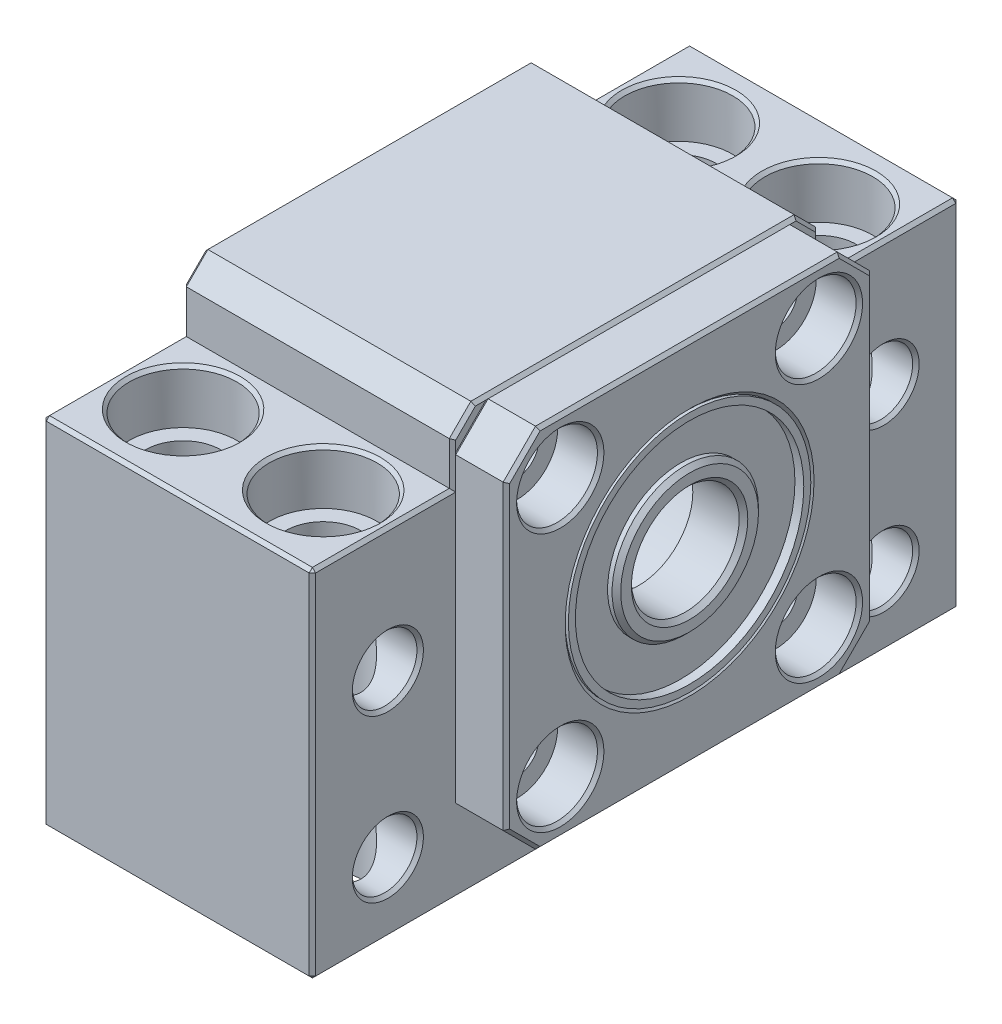
from build123d import *

# Parameters (mm, degrees)
BOSS_EXTRUDE1_DEPTH = 12.5
SKETCH2_W           = 34
SKETCH2_H           = 34
BOSS_EXTRUDE2_DEPTH = 5
SKETCH4_R           = 11.25
SKETCH4_R_2         = 2
SKETCH4_R_3         = 3
CUT_EXTRUDE1_DEPTH  = 48.791212581
SKETCH5_R           = 3.75
CUT_EXTRUDE2_DEPTH  = 4
SKETCH6_R           = 3.5
CUT_EXTRUDE3_DEPTH  = 48.908767465
SKETCH7_R           = 5
CUT_EXTRUDE4_DEPTH  = 5
CHAMFER1_SIZE       = 2
CHAMFER2_SIZE       = 3
CHAMFER3_SIZE       = 0.3
CHAMFER4_SIZE       = 0.3
CHAMFER5_SIZE       = 0.4


with BuildPart() as part:
    # Sketch1 → Boss-Extrude1 (new, symmetric)
    with BuildSketch(Plane(origin=(0, 0, 0), x_dir=(0, 0, -1), z_dir=(1, 0, 0))):
        Polygon((17, 17), (-17, 17), (-17, 11), (-30, 11), (-30, -22), (30, -22), (30, 11), (17, 11), align=None)
    extrude(amount=BOSS_EXTRUDE1_DEPTH, both=True)

    # Sketch2 → Boss-Extrude2 (add)
    with BuildSketch(Plane(origin=(12.5, 0, 0), x_dir=(0, 0, -1), z_dir=(1, 0, 0))):
        Rectangle(SKETCH2_W, SKETCH2_H)
    extrude(amount=BOSS_EXTRUDE2_DEPTH)

    # Sketch4 → Cut-Extrude1 (cut, through all)
    with BuildSketch(Plane(origin=(17.5, 0, 0), x_dir=(0, 0, -1), z_dir=(1, 0, 0))):
        Circle(SKETCH4_R)
        with Locations((-12, 12)):
            Circle(SKETCH4_R_2)
        with Locations((12, 12)):
            Circle(SKETCH4_R_2)
        with Locations((12, -12)):
            Circle(SKETCH4_R_2)
        with Locations((-12, -12)):
            Circle(SKETCH4_R_2)
        with Locations((-23, -0.5)):
            Circle(SKETCH4_R_3)
        with Locations((-23, -15.5)):
            Circle(SKETCH4_R_3)
        with Locations((23, -15.5)):
            Circle(SKETCH4_R_3)
        with Locations((23, -0.5)):
            Circle(SKETCH4_R_3)
    extrude(amount=-CUT_EXTRUDE1_DEPTH, mode=Mode.SUBTRACT)

    # Sketch5 → Cut-Extrude2 (cut)
    with BuildSketch(Plane(origin=(17.5, 0, 0), x_dir=(0, 0, -1), z_dir=(1, 0, 0))):
        with Locations((-12, 12)):
            Circle(SKETCH5_R)
        with Locations((12, 12)):
            Circle(SKETCH5_R)
        with Locations((12, -12)):
            Circle(SKETCH5_R)
        with Locations((-12, -12)):
            Circle(SKETCH5_R)
    extrude(amount=-CUT_EXTRUDE2_DEPTH, mode=Mode.SUBTRACT)

    # Sketch6 → Cut-Extrude3 (cut, through all)
    with BuildSketch(Plane(origin=(0, 11, 0), x_dir=(1, 0, 0), z_dir=(0, 1, 0))):
        with Locations((-6.5, 23)):
            Circle(SKETCH6_R)
        with Locations((6.5, 23)):
            Circle(SKETCH6_R)
        with Locations((-6.5, -23)):
            Circle(SKETCH6_R)
        with Locations((6.5, -23)):
            Circle(SKETCH6_R)
    extrude(amount=-CUT_EXTRUDE3_DEPTH, mode=Mode.SUBTRACT)

    # Sketch7 → Cut-Extrude4 (cut)
    with BuildSketch(Plane(origin=(0, 11, 0), x_dir=(1, 0, 0), z_dir=(0, 1, 0))):
        with Locations((-6.5, 23)):
            Circle(SKETCH7_R)
        with Locations((6.5, 23)):
            Circle(SKETCH7_R)
        with Locations((6.5, -23)):
            Circle(SKETCH7_R)
        with Locations((-6.5, -23)):
            Circle(SKETCH7_R)
    extrude(amount=-CUT_EXTRUDE4_DEPTH, mode=Mode.SUBTRACT)


with BuildPart() as body_2:
    # Split1: the piece on the far side of the plane
    add(part.part)
    split(bisect_by=Plane(origin=(12.5, 0, 0), x_dir=(0, 0, 1), z_dir=(1, 0, 0)), keep=Keep.BOTTOM)

    # Chamfer1
    chamfer1_edges = [body_2.edges().sort_by_distance(p)[0] for p in [
        (0, 17, -17),
        (0, 17, 17),
    ]]
    chamfer(chamfer1_edges, length=CHAMFER1_SIZE)

    # Chamfer4
    chamfer4_edges = [body_2.edges().sort_by_distance(p)[0] for p in [
        (-12.5, 0, 11.25),
        (-12.5, 12, 14),
        (-12.5, 12, -10),
        (-12.5, -12, -10),
        (-12.5, -12, 14),
        (-12.5, -0.5, 26),
        (-12.5, -15.5, 26),
        (-12.5, -15.5, -20),
        (-12.5, -0.5, -20),
        (12.5, -0.5, 26),
        (12.5, -15.5, 26),
        (12.5, -15.5, -20),
        (12.5, -0.5, -20),
        (12.5, -12, -10),
        (12.5, 12, 14),
        (12.5, 0, 11.25),
        (0, -22, -30),
        (0, 11, -30),
        (0, 11, 30),
        (-12.5, 16, 16),
        (-12.5, 13, 17),
        (-12.5, 11, 23.5),
        (-12.5, -5.5, 30),
        (-12.5, 17, 0),
        (-12.5, 16, -16),
        (-12.5, 13, -17),
        (-12.5, 11, -23.5),
        (-12.5, -5.5, -30),
        (-12.5, -22, 0),
        (0, -22, 30),
        (12.5, 11, -23.5),
        (12.5, -5.5, -30),
        (12.5, -22, 0),
        (12.5, -5.5, 30),
        (12.5, 11, 23.5),
        (12.5, 13, 17),
        (12.5, 16, 16),
        (12.5, 17, 0),
        (12.5, 16, -16),
        (12.5, 13, -17),
        (12.5, -12, 14),
        (12.5, 12, -10),
        (1.5, 11, -23),
        (-11.5, 11, -23),
        (-11.5, 11, 23),
        (1.5, 11, 23),
    ]]
    chamfer(chamfer4_edges, length=CHAMFER4_SIZE)


with BuildPart() as part_1:
    add(part.part)

    # Split1
    split(bisect_by=Plane(origin=(12.5, 0, 0), x_dir=(0, 0, 1), z_dir=(1, 0, 0)), keep=Keep.TOP)

    # Chamfer2
    chamfer2_edges = [part_1.edges().sort_by_distance(p)[0] for p in [
        (15, -17, -17),
        (15, -17, 17),
        (15, 17, -17),
        (15, 17, 17),
    ]]
    chamfer(chamfer2_edges, length=CHAMFER2_SIZE)

    # Chamfer3
    chamfer3_edges = [part_1.edges().sort_by_distance(p)[0] for p in [
        (17.5, -15.5, 15.5),
        (17.5, 0, 17),
        (17.5, 15.5, 15.5),
        (17.5, 17, 0),
        (17.5, 15.5, -15.5),
        (17.5, 0, -17),
        (17.5, -15.5, -15.5),
        (17.5, -17, 0),
        (12.5, 17, 0),
        (17.5, 0, 11.25),
        (17.5, 12, 15.75),
        (17.5, -12, 15.75),
        (17.5, -12, -8.25),
        (17.5, 12, -8.25),
        (12.5, 12, -10),
        (12.5, -12, 14),
        (12.5, 15.5, -15.5),
        (12.5, 15.5, 15.5),
        (12.5, 0, 17),
        (12.5, -15.5, 15.5),
        (12.5, -17, 0),
        (12.5, -15.5, -15.5),
        (12.5, 0, -17),
        (12.5, 0, 11.25),
        (12.5, 12, 14),
        (12.5, -12, -10),
    ]]
    chamfer(chamfer3_edges, length=CHAMFER3_SIZE)


with BuildPart() as body_3:
    # Sketch8 → Revolve1 (revolve)
    with BuildSketch(Plane(origin=(0, 0, 0), x_dir=(1, 0, 0), z_dir=(0, 1, 0))):
        Polygon((12.8, 11.25), (17.5, 11.25), (17.5, 10.596871821), (16.680865986, 10.596871821), (16.680865986, 6.792901625), (17.5, 6.792901625), (17.5, 5), (12.8, 5), align=None)
    revolve(axis=Axis((18.933095897, 0, 0), (-1, 0, 0)))

    # Chamfer5
    chamfer5_edges = [body_3.edges().sort_by_distance(p)[0] for p in [
        (17.5, 0, 5),
        (17.5, 0, 6.792901625),
    ]]
    chamfer(chamfer5_edges, length=CHAMFER5_SIZE)


with BuildPart() as body_4:
    # Mirror1: mirrored copy
    add(body_3.part.mirror(Plane(origin=(2.5, 0, 0), x_dir=(0, 0, 1), z_dir=(1, 0, 0))))


solid = Compound([body_2.part, part_1.part, body_3.part, body_4.part])
